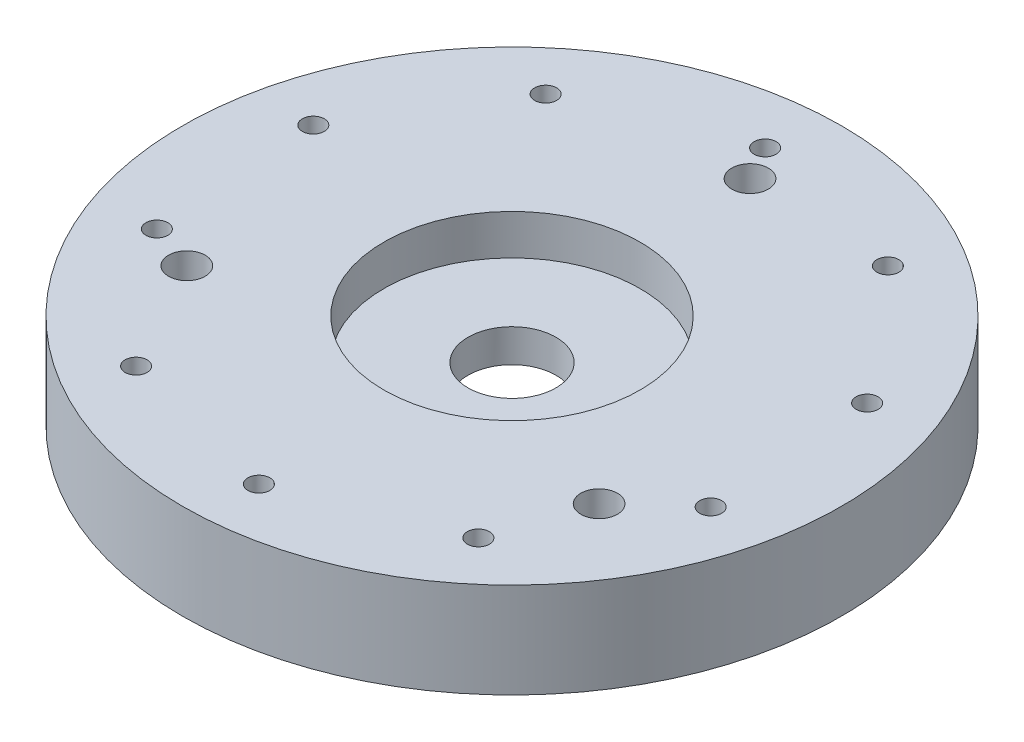
from build123d import *

# Parameters (mm, degrees)
SKETCH1_R           = 45
SKETCH1_R_2         = 2.5
SKETCH1_R_3         = 1.5
BOSS_EXTRUDE1_DEPTH = 13
SKETCH2_R           = 17.5
CUT_EXTRUDE1_DEPTH  = 5.5
SKETCH3_R           = 6
CUT_EXTRUDE2_DEPTH  = 65.08002809
SKETCH4_R           = 28.5
CUT_EXTRUDE3_DEPTH  = 3


with BuildPart() as part:
    # Sketch1 → Boss-Extrude1 (new body)
    with BuildSketch(Plane(origin=(0, 0, 0), x_dir=(1, 0, 0), z_dir=(0, 1, 0))):
        Circle(SKETCH1_R)
        with Locations((0, 32.5)):
            Circle(SKETCH1_R_2, mode=Mode.SUBTRACT)
        with Locations((28.145825623, -16.25)):
            Circle(SKETCH1_R_2, mode=Mode.SUBTRACT)
        with Locations((-28.145825623, -16.25)):
            Circle(SKETCH1_R_2, mode=Mode.SUBTRACT)
        with Locations((-34.537598583, -13.954095605)):
            Circle(SKETCH1_R_3, mode=Mode.SUBTRACT)
        with Locations((-36.143515804, 9.011590611)):
            Circle(SKETCH1_R_3, mode=Mode.SUBTRACT)
        with Locations((-23.943838461, 28.535155506)):
            Circle(SKETCH1_R_3, mode=Mode.SUBTRACT)
        with Locations((-2.598428647, 37.159260872)):
            Circle(SKETCH1_R_3, mode=Mode.SUBTRACT)
        with Locations((19.739492593, 31.589791582)):
            Circle(SKETCH1_R_3, mode=Mode.SUBTRACT)
        with Locations((34.537598583, 13.954095605)):
            Circle(SKETCH1_R_3, mode=Mode.SUBTRACT)
        with Locations((36.143515804, -9.011590611)):
            Circle(SKETCH1_R_3, mode=Mode.SUBTRACT)
        with Locations((23.943838461, -28.535155506)):
            Circle(SKETCH1_R_3, mode=Mode.SUBTRACT)
        with Locations((2.598428647, -37.159260872)):
            Circle(SKETCH1_R_3, mode=Mode.SUBTRACT)
        with Locations((-19.739492593, -31.589791582)):
            Circle(SKETCH1_R_3, mode=Mode.SUBTRACT)
    extrude(amount=BOSS_EXTRUDE1_DEPTH)

    # Sketch2 → Cut-Extrude1 (cut)
    with BuildSketch(Plane(origin=(0, 13, 0), x_dir=(1, 0, 0), z_dir=(0, 1, 0))):
        Circle(SKETCH2_R)
    extrude(amount=-CUT_EXTRUDE1_DEPTH, mode=Mode.SUBTRACT)

    # Sketch3 → Cut-Extrude2 (cut, through all)
    with BuildSketch(Plane(origin=(0, 7.5, 0), x_dir=(1, 0, 0), z_dir=(0, 1, 0))):
        Circle(SKETCH3_R)
    extrude(amount=-CUT_EXTRUDE2_DEPTH, mode=Mode.SUBTRACT)

    # Sketch4 → Cut-Extrude3 (cut)
    with BuildSketch(Plane.XZ):
        Circle(SKETCH4_R)
    extrude(amount=-CUT_EXTRUDE3_DEPTH, mode=Mode.SUBTRACT)


solid = part.part
